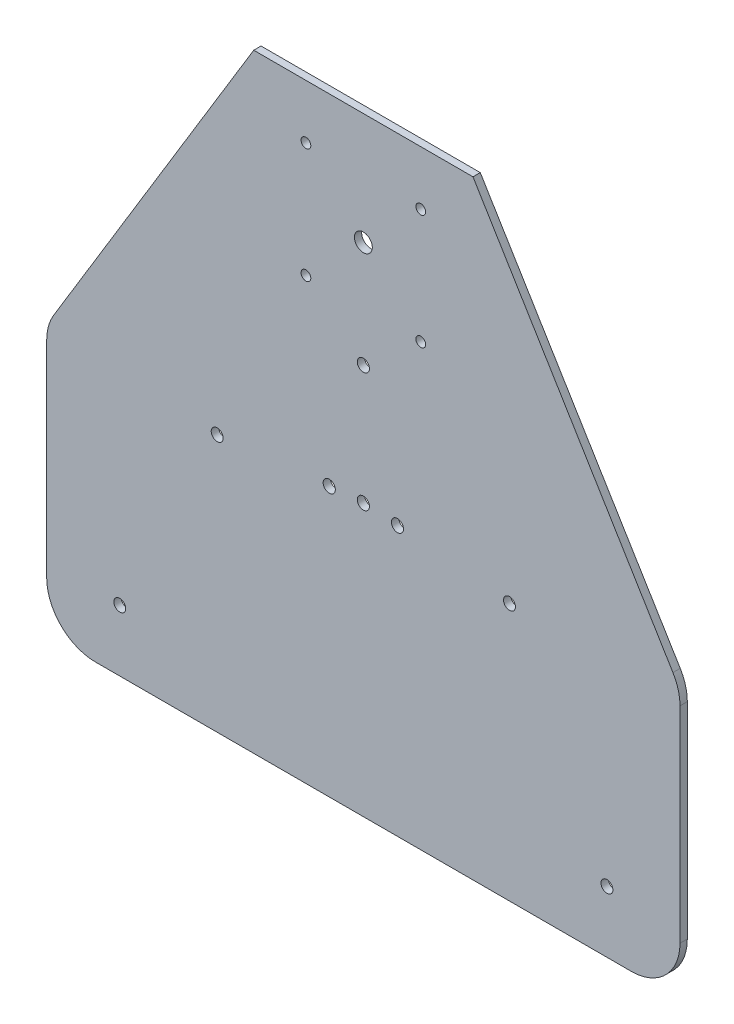
from build123d import *

# Parameters (mm, degrees)
CROQUIS1_R              = 2
CROQUIS1_R_2            = 3.675
CROQUIS1_R_3            = 2.5
CROQUIS1_R_4            = 2.45
SALIENTE_EXTRUIR1_DEPTH = 3
REDONDEO1_R             = 20
REDONDEO2_R             = 20


with BuildPart() as part:
    # Croquis1 → Saliente-Extruir1 (new body)
    with BuildSketch(Plane.XY):
        Polygon((-130, -204.2), (130, -204.2), (130, -94.2), (45, 45.8), (-45, 45.8), (-130, -94.2), align=None)
        with Locations((-23.57, 23.57)):
            Circle(CROQUIS1_R, mode=Mode.SUBTRACT)
        with Locations((23.57, 23.57)):
            Circle(CROQUIS1_R, mode=Mode.SUBTRACT)
        with Locations((-23.57, -23.57)):
            Circle(CROQUIS1_R, mode=Mode.SUBTRACT)
        with Locations((23.57, -23.57)):
            Circle(CROQUIS1_R, mode=Mode.SUBTRACT)
        Circle(CROQUIS1_R_2, mode=Mode.SUBTRACT)
        with Locations((-14, -93.7)):
            Circle(CROQUIS1_R_3, mode=Mode.SUBTRACT)
        with Locations((14, -93.7)):
            Circle(CROQUIS1_R_3, mode=Mode.SUBTRACT)
        with Locations((-60, -98.4)):
            Circle(CROQUIS1_R_4, mode=Mode.SUBTRACT)
        with Locations((60, -98.4)):
            Circle(CROQUIS1_R_4, mode=Mode.SUBTRACT)
        with Locations((-100, -179)):
            Circle(CROQUIS1_R_4, mode=Mode.SUBTRACT)
        with Locations((100, -179)):
            Circle(CROQUIS1_R_4, mode=Mode.SUBTRACT)
        with Locations((0, -43.7)):
            Circle(CROQUIS1_R_3, mode=Mode.SUBTRACT)
        with Locations((0, -92.7)):
            Circle(CROQUIS1_R_3, mode=Mode.SUBTRACT)
    extrude(amount=SALIENTE_EXTRUIR1_DEPTH)

    # Redondeo1
    redondeo1_edges = [part.edges().sort_by_distance(p)[0] for p in [
        (-130, -204.2, 1.5),
        (130, -204.2, 1.5),
    ]]
    fillet(redondeo1_edges, radius=REDONDEO1_R)

    # Redondeo2
    redondeo2_edges = [part.edges().sort_by_distance(p)[0] for p in [
        (130, -94.2, 1.5),
        (-130, -94.2, 1.5),
    ]]
    fillet(redondeo2_edges, radius=REDONDEO2_R)


solid = part.part
